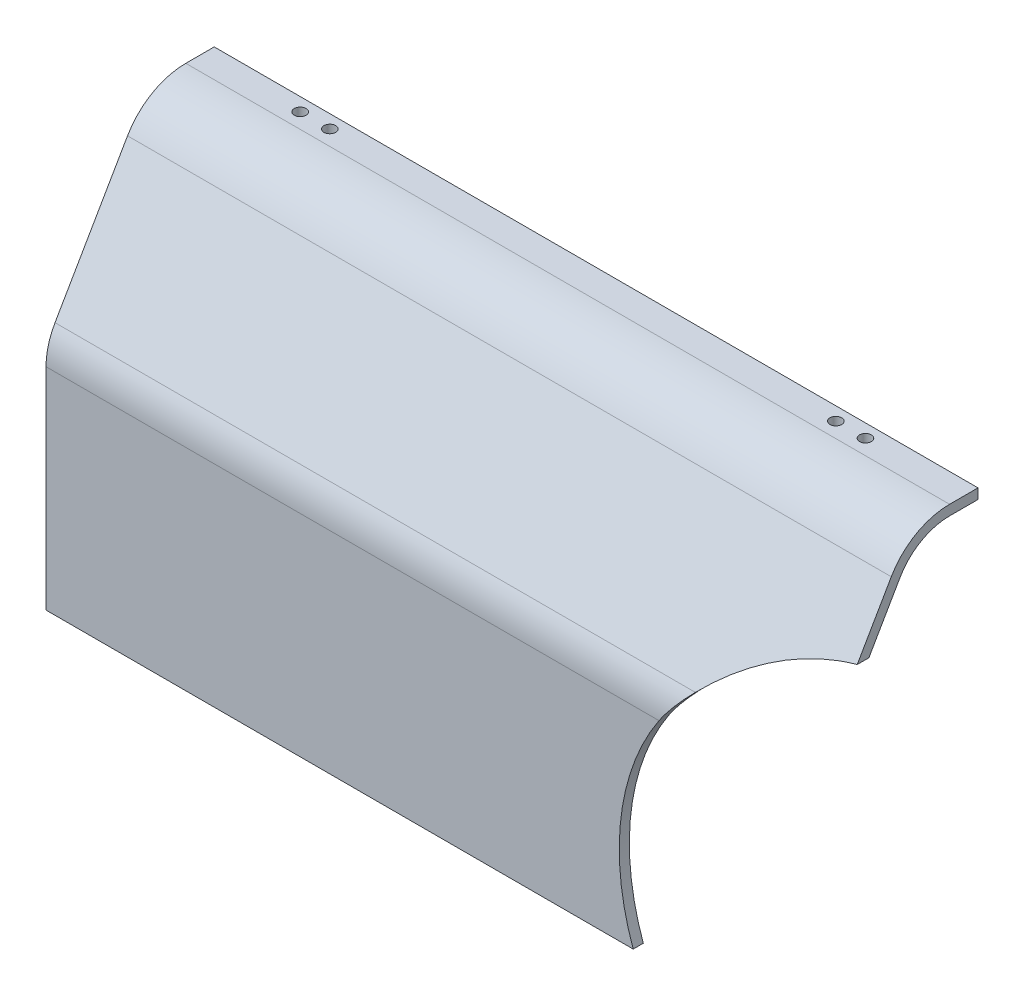
from build123d import *

# Parameters (mm, degrees)
SALIENTE_EXTRUIR1_DEPTH = 113.5
REDONDEO1_R             = 20
REDONDEO2_R             = 20
REDONDEO3_R             = 17
REDONDEO4_R             = 17
CROQUIS2_R              = 70
CORTAR_EXTRUIR1_DEPTH   = 173.54859401
CROQUIS3_R              = 1.75
CORTAR_EXTRUIR2_DEPTH   = 20


with BuildPart() as part:
    # Croquis1 → Saliente-Extruir1 (new, symmetric)
    with BuildSketch(Plane(origin=(0, 0, 0), x_dir=(0, 0, -1), z_dir=(1, 0, 0))):
        Polygon((0, 0), (0, 67.196152423), (28.732050808, 116.961524227), (47, 116.961524227), (47, 119.961524227), (27, 119.961524227), (-3, 68), (-3, 0), align=None)
    extrude(amount=SALIENTE_EXTRUIR1_DEPTH, both=True)

    # Redondeo1
    redondeo1_edges = [part.edges().sort_by_distance(p)[0] for p in [
        (0, 68, 3),
    ]]
    fillet(redondeo1_edges, radius=REDONDEO1_R)

    # Redondeo2
    redondeo2_edges = [part.edges().sort_by_distance(p)[0] for p in [
        (0, 119.961524227, -27),
    ]]
    fillet(redondeo2_edges, radius=REDONDEO2_R)

    # Redondeo3
    redondeo3_edges = [part.edges().sort_by_distance(p)[0] for p in [
        (0, 116.961524227, -28.732050808),
    ]]
    fillet(redondeo3_edges, radius=REDONDEO3_R)

    # Redondeo4
    redondeo4_edges = [part.edges().sort_by_distance(p)[0] for p in [
        (0, 67.196152423, 0),
    ]]
    fillet(redondeo4_edges, radius=REDONDEO4_R)

    # Croquis2 → Cortar-Extruir1 (cut, through all)
    with BuildSketch(Plane.XY.offset(3)):
        with Locations((126.88, 23.721524227)):
            Circle(CROQUIS2_R)
    extrude(amount=-CORTAR_EXTRUIR1_DEPTH, mode=Mode.SUBTRACT)

    # Croquis3 → Cortar-Extruir2 (cut)
    with BuildSketch(Plane(origin=(0, 119.961524227, 0), x_dir=(1, 0, 0), z_dir=(0, 1, 0))):
        with Locations((-84, 43.047005384)):
            Circle(CROQUIS3_R)
        with Locations((-75.2, 43.047005384)):
            Circle(CROQUIS3_R)
        with Locations((75.2, 43.047005384)):
            Circle(CROQUIS3_R)
        with Locations((84, 43.047005384)):
            Circle(CROQUIS3_R)
    extrude(amount=-CORTAR_EXTRUIR2_DEPTH, mode=Mode.SUBTRACT)


solid = part.part
